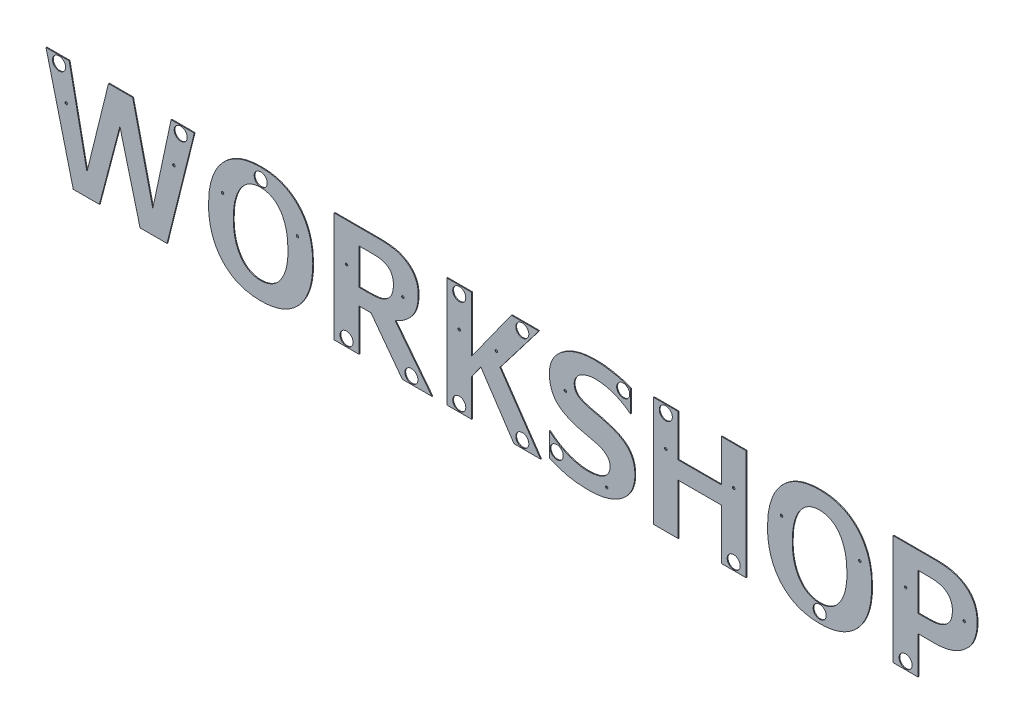
from build123d import *

# Parameters (mm, degrees)
SKETCH1_R           = 8
SKETCH1_R_2         = 1.5
BOSS_EXTRUDE1_DEPTH = 1
SKETCH2_R           = 1.5
SKETCH2_R_2         = 8
BOSS_EXTRUDE2_DEPTH = 1
SKETCH3_R           = 1.5
SKETCH3_R_2         = 8
BOSS_EXTRUDE3_DEPTH = 1
SKETCH4_R           = 8
SKETCH4_R_2         = 1.5
BOSS_EXTRUDE4_DEPTH = 1
SKETCH5_R           = 8
SKETCH5_R_2         = 1.5
BOSS_EXTRUDE5_DEPTH = 1
SKETCH6_R           = 8
SKETCH6_R_2         = 1.5
BOSS_EXTRUDE6_DEPTH = 1
SKETCH7_R           = 1.5
SKETCH7_R_2         = 8
BOSS_EXTRUDE7_DEPTH = 1
SKETCH8_R           = 8
SKETCH8_R_2         = 1.5
BOSS_EXTRUDE8_DEPTH = 1


with BuildPart() as part:
    # Sketch1 → Boss-Extrude1 (new body)
    with BuildSketch(Plane.XY):
        Polygon((2759.755662355, -1507.082577839), (2731.301339676, -1507.082577839), (2708.823457027, -1612.534372983), (2684.156370443, -1507.082577839), (2654.494132589, -1507.082577839), (2628.049756893, -1614.182299409), (2606.24852158, -1507.082577839), (2577.817119002, -1507.082577839), (2611.264112673, -1641.082577839), (2643.35275597, -1641.082577839), (2668.475428509, -1545.628632482), (2693.231792335, -1641.082577839), (2726.308668685, -1641.082577839), align=None)
        with Locations((2593.836071001, -1516.082577839)):
            Circle(SKETCH1_R, mode=Mode.SUBTRACT)
        with Locations((2602.702061357, -1553.882724844)):
            Circle(SKETCH1_R_2, mode=Mode.SUBTRACT)
        with Locations((2734.646317255, -1553.882724844)):
            Circle(SKETCH1_R_2, mode=Mode.SUBTRACT)
        with Locations((2743.072153395, -1516.082577839)):
            Circle(SKETCH1_R, mode=Mode.SUBTRACT)
    extrude(amount=BOSS_EXTRUDE1_DEPTH)


with BuildPart() as body_2:
    # Sketch2 → Boss-Extrude2 (new body)
    with BuildSketch(Plane.XY.offset(-0.5)):
        with BuildLine():
            add(Edge.make_bspline(
                [(2904.640412161, -1574.138154088), (2904.599424902, -1571.881958298), (2904.558217204, -1569.625798751), (2904.3384478, -1565.136062855), (2904.149464239, -1562.904200024), (2903.613515164, -1558.466449124), (2903.271985358, -1556.259667336), (2902.426310264, -1551.872840348), (2901.921696825, -1549.692872119), (2900.710114641, -1545.366206109), (2899.997230514, -1543.218478156), (2898.758112535, -1540.030930233), (2898.320738683, -1538.982458051), (2897.401210027, -1536.911357394), (2896.919022802, -1535.88874763), (2895.901473769, -1533.874215891), (2895.365947538, -1532.882388806), (2894.234287215, -1530.933712272), (2893.638174633, -1529.97685041), (2892.391244374, -1528.094697754), (2891.74062578, -1527.169292066), (2890.387715669, -1525.34830185), (2889.683920913, -1524.451125823), (2887.495195291, -1521.820516603), (2885.950453946, -1520.168210181), (2882.678126978, -1517.080284478), (2880.948462452, -1515.647128887), (2878.220777499, -1513.655235621), (2877.289960467, -1513.016855793), (2875.859332393, -1512.100056184), (2875.376695376, -1511.801283614), (2874.399459292, -1511.217914597), (2873.903931492, -1510.932812578), (2871.407535869, -1509.550811843), (2869.357387674, -1508.589926045), (2865.169875267, -1506.906152635), (2863.03230138, -1506.183837192), (2859.761160263, -1505.277138791), (2858.660061851, -1505.00415376), (2856.437639784, -1504.513375063), (2855.316606002, -1504.295841356), (2851.953254525, -1503.724954012), (2849.700739624, -1503.453430079), (2845.174090452, -1503.139744071), (2842.900735598, -1503.089313082), (2840.627384928, -1503.038837703)],
                knots=[0, 0, 0, 0, 0.0625, 0.0625, 0.125, 0.125, 0.1875, 0.1875, 0.25, 0.25, 0.3125, 0.3125, 0.34375, 0.34375, 0.375, 0.375, 0.40625, 0.40625, 0.4375, 0.4375, 0.46875, 0.46875, 0.5, 0.5, 0.5625, 0.5625, 0.625, 0.625, 0.65625, 0.65625, 0.671875, 0.671875, 0.6875, 0.6875, 0.75, 0.75, 0.8125, 0.8125, 0.84375, 0.84375, 0.875, 0.875, 0.9375, 0.9375, 1, 1, 1, 1], degree=3))
            add(Edge.make_bspline(
                [(2840.627384928, -1503.038837703), (2838.370165297, -1503.084690575), (2836.112987146, -1503.130774037), (2831.639016621, -1503.447447188), (2829.42426755, -1503.729395685), (2825.026884477, -1504.471821698), (2822.842703797, -1504.923701163), (2818.519229103, -1506.076986959), (2816.38102695, -1506.784462985), (2813.738759412, -1507.838276264), (2813.211320983, -1508.057674174), (2812.167571791, -1508.510454737), (2810.615848545, -1509.211717034), (2809.10659788, -1509.980478927), (2806.146490118, -1511.610804758), (2804.250429749, -1512.820608962), (2801.512799625, -1514.804507625), (2800.6183518, -1515.494565553), (2799.305642772, -1516.575681461), (2798.872891952, -1516.943711803), (2798.017317088, -1517.695548626), (2797.594489795, -1518.079419388), (2795.520860393, -1520.024775908), (2793.974776075, -1521.671653536), (2791.078162883, -1525.122437376), (2789.731157039, -1526.929172536), (2787.863490307, -1529.762005523), (2787.26545091, -1530.725969372), (2786.118086497, -1532.693014111), (2785.571702617, -1533.691345338), (2784.536303689, -1535.706744512), (2784.047125964, -1536.725617542), (2783.127299178, -1538.786292315), (2782.697082562, -1539.828263469), (2781.888846555, -1541.932654134), (2781.510777703, -1542.99505427), (2780.79967544, -1545.137497259), (2780.466352205, -1546.217426572), (2779.844581943, -1548.394865537), (2779.556309868, -1549.49381445), (2779.026405701, -1551.703870077), (2778.785498358, -1552.811569825), (2778.131410501, -1556.142295935), (2777.782085437, -1558.372418135), (2777.232328461, -1562.849208054), (2777.03830014, -1565.096587364), (2776.813129577, -1569.609446444), (2776.771414488, -1571.873751325), (2776.729847707, -1574.138072686)],
                knots=[0, 0, 0, 0, 0.0625, 0.0625, 0.125, 0.125, 0.1875, 0.1875, 0.25, 0.25, 0.265625, 0.265625, 0.28125, 0.3125, 0.3125, 0.375, 0.375, 0.40625, 0.40625, 0.421875, 0.421875, 0.4375, 0.4375, 0.5, 0.5, 0.5625, 0.5625, 0.59375, 0.59375, 0.625, 0.625, 0.65625, 0.65625, 0.6875, 0.6875, 0.71875, 0.71875, 0.75, 0.75, 0.78125, 0.78125, 0.8125, 0.8125, 0.875, 0.875, 0.9375, 0.9375, 1, 1, 1, 1], degree=3))
            add(Edge.make_bspline(
                [(2776.729847707, -1574.138072686), (2776.771005904, -1576.391456455), (2776.812383928, -1578.644804316), (2777.039123288, -1583.127981363), (2777.235420315, -1585.356024278), (2777.785683786, -1589.786355903), (2778.132978537, -1591.989734387), (2778.995099723, -1596.369126216), (2779.514498321, -1598.544392729), (2780.439402647, -1601.783476029), (2780.770613934, -1602.859428298), (2781.482888685, -1605.003189828), (2781.865238801, -1606.073681573), (2782.680779822, -1608.191874263), (2783.113370847, -1609.236950558), (2784.033551867, -1611.296036573), (2784.520890751, -1612.310188135), (2785.546148736, -1614.309920651), (2786.08390434, -1615.295593958), (2787.208167873, -1617.23940246), (2787.794813002, -1618.197460157), (2789.024068288, -1620.081963294), (2789.667806534, -1621.007771523), (2790.678244719, -1622.37116085), (2791.022446882, -1622.821449982), (2791.725549875, -1623.713725596), (2792.084858539, -1624.156162912), (2793.905961698, -1626.333785397), (2795.443425796, -1627.982526045), (2798.695257524, -1631.075056718), (2800.413546185, -1632.514304053), (2803.130474625, -1634.511563365), (2804.059054144, -1635.150743273), (2805.487447407, -1636.068357018), (2805.969508908, -1636.367357619), (2806.945716686, -1636.951358067), (2807.44041048, -1637.236624685), (2809.925870387, -1638.617223042), (2811.96592611, -1639.583309941), (2816.139818176, -1641.264390295), (2818.273773813, -1641.979064341), (2821.540085214, -1642.876028862), (2822.639634501, -1643.146157226), (2824.858309939, -1643.633997765), (2825.976019854, -1643.851235887), (2829.32964463, -1644.428867449), (2831.575244278, -1644.712589634), (2836.090487362, -1645.032596326), (2838.359109461, -1645.079391536), (2840.627720035, -1645.126305346)],
                knots=[0, 0, 0, 0, 0.0625, 0.0625, 0.125, 0.125, 0.1875, 0.1875, 0.25, 0.25, 0.28125, 0.28125, 0.3125, 0.3125, 0.34375, 0.34375, 0.375, 0.375, 0.40625, 0.40625, 0.4375, 0.4375, 0.46875, 0.46875, 0.484375, 0.484375, 0.5, 0.5, 0.5625, 0.5625, 0.625, 0.625, 0.65625, 0.65625, 0.671875, 0.671875, 0.6875, 0.6875, 0.75, 0.75, 0.8125, 0.8125, 0.84375, 0.84375, 0.875, 0.875, 0.9375, 0.9375, 1, 1, 1, 1], degree=3))
            add(Edge.make_bspline(
                [(2840.627720035, -1645.126305346), (2842.885693296, -1645.075954102), (2845.143614543, -1645.025310654), (2849.622975166, -1644.719073001), (2851.84298178, -1644.455429704), (2856.245197117, -1643.715799115), (2858.427660185, -1643.241240696), (2862.753134266, -1642.070486957), (2864.896518874, -1641.376390452), (2867.544750209, -1640.334618785), (2868.072767763, -1640.117470454), (2869.117212144, -1639.668700797), (2870.669654097, -1638.972649317), (2872.179333786, -1638.207764548), (2875.14159505, -1636.586085675), (2877.040628514, -1635.382941286), (2879.781077495, -1633.404217019), (2880.676361998, -1632.715348633), (2882.429525512, -1631.277401223), (2883.290169037, -1630.52564977), (2885.786752736, -1628.204739083), (2887.341534643, -1626.568030521), (2890.247381667, -1623.128389278), (2891.601434792, -1621.327894684), (2893.487852316, -1618.509114702), (2894.09167209, -1617.549133821), (2895.244463778, -1615.58441857), (2895.788272687, -1614.586633692), (2896.816712121, -1612.569881847), (2897.30205654, -1611.550020247), (2898.224318874, -1609.491034519), (2898.661669831, -1608.452082641), (2899.899011575, -1605.305509292), (2900.620846101, -1603.166799738), (2901.549806022, -1599.897561878), (2901.835432997, -1598.796247238), (2902.359196114, -1596.584664664), (2902.597008528, -1595.476181163), (2903.24631502, -1592.143557423), (2903.594887783, -1589.912379227), (2904.142553387, -1585.433303009), (2904.335537823, -1583.184721743), (2904.558662159, -1578.669344509), (2904.599609856, -1576.40375743), (2904.640412161, -1574.138154088)],
                knots=[0, 0, 0, 0, 0.0625, 0.0625, 0.125, 0.125, 0.1875, 0.1875, 0.25, 0.25, 0.265625, 0.265625, 0.28125, 0.3125, 0.3125, 0.375, 0.375, 0.40625, 0.40625, 0.4375, 0.4375, 0.5, 0.5, 0.5625, 0.5625, 0.59375, 0.59375, 0.625, 0.625, 0.65625, 0.65625, 0.6875, 0.6875, 0.75, 0.75, 0.78125, 0.78125, 0.8125, 0.8125, 0.875, 0.875, 0.9375, 0.9375, 1, 1, 1, 1], degree=3))
        make_face()
        with Locations((2793.950399869, -1553.882724844)):
            Circle(SKETCH2_R, mode=Mode.SUBTRACT)
        with Locations((2885.883859605, -1553.882724844)):
            Circle(SKETCH2_R, mode=Mode.SUBTRACT)
        with Locations((2840.740504603, -1516.082577839)):
            Circle(SKETCH2_R_2, mode=Mode.SUBTRACT)
        with BuildLine():
            add(Edge.make_bspline(
                [(2864.360405759, -1536.436135911), (2863.633720327, -1535.553149345), (2862.907370028, -1534.669800364), (2861.380251656, -1532.983578207), (2860.579110094, -1532.181108922), (2858.869209126, -1530.692548901), (2857.957382694, -1530.009774864), (2856.516055787, -1529.065191488), (2856.021967565, -1528.762044422), (2855.023934086, -1528.189370761), (2854.518987239, -1527.919443126), (2851.963604965, -1526.65461111), (2849.818598155, -1525.921395116), (2847.037470939, -1525.281221718), (2846.476521634, -1525.166258432), (2845.343140145, -1524.968106126), (2844.771524008, -1524.885185757), (2843.056115205, -1524.696523652), (2841.905579734, -1524.65756686), (2840.754959407, -1524.619673184)],
                knots=[0, 0, 0, 0, 0.125, 0.125, 0.25, 0.25, 0.375, 0.375, 0.4375, 0.4375, 0.5, 0.5, 0.75, 0.75, 0.8125, 0.8125, 0.875, 0.875, 1, 1, 1, 1], degree=3))
            add(Edge.make_bspline(
                [(2840.754959407, -1524.619673184), (2839.613485668, -1524.644060725), (2838.472177084, -1524.669334027), (2836.218752304, -1524.876445778), (2835.105908681, -1525.054382885), (2832.898924166, -1525.51056393), (2831.805222003, -1525.791160864), (2830.186602584, -1526.329692172), (2829.650604353, -1526.528196844), (2828.585513013, -1526.962239878), (2828.06025369, -1527.196320867), (2826.51882984, -1527.94294569), (2825.534907969, -1528.507337637), (2824.13713938, -1529.473065245), (2823.683005045, -1529.812954292), (2822.791229584, -1530.517887804), (2822.352955023, -1530.881966155), (2821.488947466, -1531.629251231), (2821.063096127, -1532.014298823), (2820.236071733, -1532.805466737), (2819.834884494, -1533.212398338), (2818.66975282, -1534.468575854), (2817.941116035, -1535.350329678), (2817.212092919, -1536.231727806)],
                knots=[0, 0, 0, 0, 0.125, 0.125, 0.25, 0.25, 0.375, 0.375, 0.4375, 0.4375, 0.5, 0.5, 0.625, 0.625, 0.6875, 0.6875, 0.75, 0.75, 0.8125, 0.8125, 0.875, 0.875, 1, 1, 1, 1], degree=3))
            add(Edge.make_bspline(
                [(2817.212092919, -1536.231727806), (2816.72901279, -1536.913130491), (2816.245489604, -1537.594317747), (2815.32191026, -1538.977827453), (2814.884943724, -1539.681652185), (2814.072834103, -1541.119362382), (2813.694717842, -1541.851802184), (2812.975686264, -1543.334770192), (2812.633591197, -1544.084724762), (2811.983497189, -1545.601212636), (2811.675810395, -1546.367897716), (2811.097298324, -1547.91919124), (2810.826547276, -1548.703835776), (2810.315934796, -1550.288144464), (2810.075863674, -1551.088442686), (2809.622765716, -1552.692190685), (2809.196539298, -1554.301479277), (2808.836269552, -1555.924367358), (2808.514764283, -1557.555248216), (2808.373309785, -1558.374667693), (2808.119956635, -1560.019600714), (2808.008078372, -1560.845118462), (2807.804684631, -1562.500352523), (2807.712465185, -1563.329384594), (2807.468061789, -1565.817189329), (2807.351141971, -1567.478331942), (2807.218147648, -1570.806328582), (2807.19525249, -1572.472796319), (2807.172209694, -1574.139255695)],
                knots=[0, 0, 0, 0, 0.0625, 0.0625, 0.125, 0.125, 0.1875, 0.1875, 0.25, 0.25, 0.3125, 0.3125, 0.375, 0.375, 0.4375, 0.4375, 0.5, 0.5625, 0.5625, 0.625, 0.625, 0.6875, 0.6875, 0.75, 0.75, 0.875, 0.875, 1, 1, 1, 1], degree=3))
            add(Edge.make_bspline(
                [(2807.172209694, -1574.139255695), (2807.196756449, -1575.790457688), (2807.221154091, -1577.441666078), (2807.341523724, -1580.741012911), (2807.441922113, -1582.3889615), (2807.737506354, -1585.680793084), (2807.927867745, -1587.320596255), (2808.415953288, -1590.582796362), (2808.717459338, -1592.204877598), (2809.464519318, -1595.426431863), (2809.904702647, -1597.012355482), (2810.922818439, -1600.117789109), (2811.503469992, -1601.638450272), (2812.478286034, -1603.872948827), (2812.819606918, -1604.610446641), (2813.536223061, -1606.070230436), (2813.91268475, -1606.791994156), (2814.718201261, -1608.211973321), (2815.150267072, -1608.908840612), (2816.058462972, -1610.282845668), (2816.532152554, -1610.961076154), (2817.005430821, -1611.639490805)],
                knots=[0, 0, 0, 0, 0.125, 0.125, 0.25, 0.25, 0.375, 0.375, 0.5, 0.5, 0.625, 0.625, 0.75, 0.75, 0.8125, 0.8125, 0.875, 0.875, 0.9375, 0.9375, 1, 1, 1, 1], degree=3))
            add(Edge.make_bspline(
                [(2817.005430821, -1611.639490805), (2817.730183995, -1612.532827844), (2818.45476254, -1613.426357204), (2819.985199531, -1615.123901408), (2820.792210468, -1615.926647001), (2822.503570651, -1617.424938356), (2823.408222546, -1618.120150807), (2825.322496048, -1619.394971324), (2826.340718937, -1619.976279953), (2829.447089359, -1621.496137809), (2831.610122164, -1622.237450518), (2834.409246662, -1622.882677275), (2834.973780902, -1622.997821163), (2836.113769773, -1623.195873132), (2836.690227115, -1623.278662191), (2838.420078655, -1623.46740589), (2839.579683527, -1623.507014853), (2840.739336385, -1623.54597436)],
                knots=[0, 0, 0, 0, 0.125, 0.125, 0.25, 0.25, 0.375, 0.375, 0.5, 0.5, 0.75, 0.75, 0.8125, 0.8125, 0.875, 0.875, 1, 1, 1, 1], degree=3))
            add(Edge.make_bspline(
                [(2840.739336385, -1623.54597436), (2841.898765769, -1623.508106528), (2843.057978041, -1623.469190294), (2845.341526931, -1623.22294877), (2846.467370806, -1623.022901786), (2848.689873557, -1622.481878037), (2849.786766434, -1622.14203123), (2851.416986258, -1621.559251367), (2851.957630449, -1621.351652134), (2853.031656043, -1620.901382807), (2853.559892455, -1620.660481739), (2855.110178064, -1619.886869891), (2856.101705315, -1619.305421918), (2858.01141713, -1618.02777569), (2858.928632281, -1617.330060712), (2860.239561428, -1616.181957242), (2860.665341317, -1615.782880089), (2861.486689853, -1614.962448122), (2861.883592648, -1614.539950493), (2863.036043372, -1613.238338743), (2863.753918546, -1612.325627389), (2864.4720951, -1611.41318481)],
                knots=[0, 0, 0, 0, 0.125, 0.125, 0.25, 0.25, 0.375, 0.375, 0.4375, 0.4375, 0.5, 0.5, 0.625, 0.625, 0.75, 0.75, 0.8125, 0.8125, 0.875, 0.875, 1, 1, 1, 1], degree=3))
            add(Edge.make_bspline(
                [(2864.4720951, -1611.41318481), (2864.930812822, -1610.730312721), (2865.38991759, -1610.04765827), (2866.279426882, -1608.666210966), (2866.708480936, -1607.966658731), (2867.924030641, -1605.827733703), (2868.649238784, -1604.353898397), (2869.967804621, -1601.3320871), (2870.553272182, -1599.800295445), (2871.580546574, -1596.70315457), (2872.019231088, -1595.135839527), (2872.747789104, -1591.963993912), (2873.034787488, -1590.358744314), (2873.381000444, -1587.929791525), (2873.482904977, -1587.11676449), (2873.668125584, -1585.48606171), (2873.751360289, -1584.66844159), (2873.895958654, -1583.033455659), (2873.9574034, -1582.21545449), (2874.056072226, -1580.578318142), (2874.092411483, -1579.759141536), (2874.171005892, -1577.300187299), (2874.184459609, -1575.659061187), (2874.197943563, -1574.01793649)],
                knots=[0, 0, 0, 0, 0.0625, 0.0625, 0.125, 0.125, 0.25, 0.25, 0.375, 0.375, 0.5, 0.5, 0.625, 0.625, 0.6875, 0.6875, 0.75, 0.75, 0.8125, 0.8125, 0.875, 0.875, 1, 1, 1, 1], degree=3))
            add(Edge.make_bspline(
                [(2874.197943563, -1574.01793649), (2874.172125838, -1572.36572337), (2874.146398325, -1570.713506204), (2874.020949863, -1567.412390657), (2873.917369239, -1565.763665392), (2873.455495948, -1560.824268208), (2872.96074873, -1557.560320695), (2872.009686891, -1553.536141073), (2871.803038981, -1552.735825072), (2871.35665651, -1551.152186985), (2871.116631284, -1550.367815195), (2870.606172259, -1548.812524184), (2870.335761324, -1548.041594846), (2869.767493528, -1546.511878082), (2869.469373674, -1545.753207001), (2868.840654231, -1544.250233675), (2868.510304959, -1543.505820692), (2867.810953359, -1542.0340946), (2867.441318158, -1541.307061472), (2866.645346092, -1539.878079685), (2866.215965975, -1539.177477342), (2865.309225241, -1537.797498936), (2864.834565746, -1537.116927914), (2864.360405759, -1536.436135911)],
                knots=[0, 0, 0, 0, 0.125, 0.125, 0.25, 0.25, 0.5, 0.5, 0.5625, 0.5625, 0.625, 0.625, 0.6875, 0.6875, 0.75, 0.75, 0.8125, 0.8125, 0.875, 0.875, 0.9375, 0.9375, 1, 1, 1, 1], degree=3))
        make_face(mode=Mode.SUBTRACT)
    extrude(amount=BOSS_EXTRUDE2_DEPTH)


with BuildPart() as body_3:
    # Sketch3 → Boss-Extrude3 (new body)
    with BuildSketch(Plane.XY.offset(-0.5)):
        with BuildLine():
            Line((3050.878080136, -1641.582577839), (3005.740127588, -1583.767239691))
            add(Edge.make_bspline(
                [(3005.740127588, -1583.767239691), (3006.723035758, -1583.259422493), (3007.706669908, -1582.752634859), (3009.671704815, -1581.735892257), (3010.653399226, -1581.226353741), (3012.589043332, -1580.167929948), (3013.541769008, -1579.617308802), (3015.395810038, -1578.443157866), (3016.297271213, -1577.819834874), (3018.057098076, -1576.512072107), (3018.916258388, -1575.828759246), (3020.595413275, -1574.406589796), (3021.414432354, -1573.666349788), (3023.006110399, -1572.12012319), (3023.779912392, -1571.312743933), (3025.269327491, -1569.628053217), (3025.976024558, -1568.761898474), (3027.312199469, -1566.981219642), (3027.943467679, -1566.06781702), (3029.108211416, -1564.179755421), (3029.639291226, -1563.203595791), (3030.357725626, -1561.690381848), (3030.583908565, -1561.177649224), (3031.01374527, -1560.138071929), (3031.21786923, -1559.610570663), (3031.795883356, -1558.024324766), (3032.136478555, -1556.956941473), (3032.718411815, -1554.800246114), (3032.958608306, -1553.710681842), (3033.348317079, -1551.511518534), (3033.501021445, -1550.402624721), (3033.762537326, -1548.175139895), (3033.866961302, -1547.053541705), (3033.979142104, -1544.808874676), (3033.993163643, -1543.684842754), (3034.007489955, -1542.560823136)],
                knots=[0, 0, 0, 0, 0.0625, 0.0625, 0.125, 0.125, 0.1875, 0.1875, 0.25, 0.25, 0.3125, 0.3125, 0.375, 0.375, 0.4375, 0.4375, 0.5, 0.5, 0.5625, 0.5625, 0.625, 0.625, 0.65625, 0.65625, 0.6875, 0.6875, 0.75, 0.75, 0.8125, 0.8125, 0.875, 0.875, 0.9375, 0.9375, 1, 1, 1, 1], degree=3))
            add(Edge.make_bspline(
                [(3034.007489955, -1542.560823136), (3033.9698884, -1541.134128517), (3033.93240101, -1539.707418005), (3033.770895845, -1537.582007403), (3033.697745128, -1536.876226129), (3033.507151109, -1535.470829536), (3033.390658968, -1534.771081806), (3033.117966945, -1533.377114046), (3032.96243536, -1532.682800983), (3032.609740933, -1531.299970329), (3032.410971883, -1530.60899312), (3031.957507897, -1529.247368753), (3031.703270787, -1528.581599335), (3031.135832394, -1527.28230847), (3030.824179913, -1526.647939971), (3029.82125269, -1524.782007683), (3029.066651542, -1523.585077605), (3027.812354004, -1521.856621725), (3027.371525698, -1521.290205949), (3026.459302774, -1520.192141943), (3025.987727525, -1519.659654462), (3024.531519156, -1518.106573784), (3023.509454083, -1517.126028588), (3021.30701686, -1515.33430906), (3020.121054905, -1514.52808981), (3018.937320355, -1513.723317291)],
                knots=[0, 0, 0, 0, 0.125, 0.125, 0.1875, 0.1875, 0.25, 0.25, 0.3125, 0.3125, 0.375, 0.375, 0.4375, 0.4375, 0.5, 0.5, 0.625, 0.625, 0.6875, 0.6875, 0.75, 0.75, 0.875, 0.875, 1, 1, 1, 1], degree=3))
            add(Edge.make_bspline(
                [(3018.937320355, -1513.723317291), (3017.650135804, -1512.955523753), (3016.36244116, -1512.188779274), (3013.682119391, -1510.87109466), (3012.296807506, -1510.305109989), (3010.1758468, -1509.544552221), (3009.464104135, -1509.309429976), (3008.030670917, -1508.885279143), (3007.308523157, -1508.697047792), (3005.127580198, -1508.196010835), (3003.655581846, -1507.941170263), (3000.6934006, -1507.51132365), (2999.205451725, -1507.336651497), (2996.230333787, -1507.035461341), (2994.741050075, -1506.913649624), (2991.758810263, -1506.731312801), (2990.265847512, -1506.670898678), (2987.27673007, -1506.603339105), (2985.780769101, -1506.592960702), (2984.2848084, -1506.582577839)],
                knots=[0, 0, 0, 0, 0.125, 0.125, 0.25, 0.25, 0.3125, 0.3125, 0.375, 0.375, 0.5, 0.5, 0.625, 0.625, 0.75, 0.75, 0.875, 0.875, 1, 1, 1, 1], degree=3))
            Line((2984.2848084, -1506.582577839), (2930.906643843, -1506.582577839))
            Line((2930.906643843, -1506.582577839), (2930.906643843, -1641.582577839))
            Line((2930.906643843, -1641.582577839), (2961.349681818, -1641.582577839))
            Line((2961.349681818, -1641.582577839), (2961.349681818, -1590.190172775))
            Line((2961.349681818, -1590.190172775), (2976.066489744, -1590.190172775))
            Line((2976.066489744, -1590.190172775), (3014.527723921, -1641.582577839))
            Line((3014.527723921, -1641.582577839), (3050.878080136, -1641.582577839))
        make_face()
        with Locations((3015.241559587, -1553.882724844)):
            Circle(SKETCH3_R, mode=Mode.SUBTRACT)
        with Locations((2946.128162831, -1553.882724844)):
            Circle(SKETCH3_R, mode=Mode.SUBTRACT)
        with Locations((2946.099681818, -1632.582577839)):
            Circle(SKETCH3_R_2, mode=Mode.SUBTRACT)
        with Locations((3025.670217733, -1632.582577839)):
            Circle(SKETCH3_R_2, mode=Mode.SUBTRACT)
        with BuildLine():
            Line((2961.349681818, -1570.380046193), (2973.744355522, -1570.380002117))
            add(Edge.make_bspline(
                [(2973.744355522, -1570.380002117), (2975.709572857, -1570.361550087), (2977.674731035, -1570.341053765), (2980.617996705, -1570.155782519), (2981.596558822, -1570.066091454), (2983.060698464, -1569.903318185), (2983.548313734, -1569.845291517), (2984.522798685, -1569.722722527), (2985.00952372, -1569.656916146), (2985.980562247, -1569.504229039), (2986.464834856, -1569.417209688), (2987.42179263, -1569.215033513), (2987.895539132, -1569.100445087), (2989.30057408, -1568.71045216), (2990.215131795, -1568.387318971), (2991.556234412, -1567.814942713), (2991.998479218, -1567.610487639), (2992.871346809, -1567.168422704), (2993.303676518, -1566.929074461), (2994.14017347, -1566.410707896), (2994.543507328, -1566.130521164), (2995.331009195, -1565.543157473), (2995.715578684, -1565.236545896), (2996.100217518, -1564.930031973)],
                knots=[0, 0, 0, 0, 0.25, 0.25, 0.375, 0.375, 0.4375, 0.4375, 0.5, 0.5, 0.5625, 0.5625, 0.625, 0.625, 0.75, 0.75, 0.8125, 0.8125, 0.875, 0.875, 0.9375, 0.9375, 1, 1, 1, 1], degree=3))
            add(Edge.make_bspline(
                [(2996.100217518, -1564.930031973), (2996.750187944, -1564.367318701), (2997.39793098, -1563.802768), (2998.578993561, -1562.579275836), (2999.119289103, -1561.926089046), (3000.110686567, -1560.546137446), (3000.562034514, -1559.819575589), (3001.380174375, -1558.296699517), (3001.736574478, -1557.515054375), (3002.337628095, -1555.919691372), (3002.582082291, -1555.104217859), (3002.970584835, -1553.441411753), (3003.118147761, -1552.593038037), (3003.350144817, -1550.886480845), (3003.430894799, -1550.03070905), (3003.527926011, -1548.314605458), (3003.546526253, -1547.454437689), (3003.565297852, -1546.59428204)],
                knots=[0, 0, 0, 0, 0.125, 0.125, 0.25, 0.25, 0.375, 0.375, 0.5, 0.5, 0.625, 0.625, 0.75, 0.75, 0.875, 0.875, 1, 1, 1, 1], degree=3))
            add(Edge.make_bspline(
                [(3003.565297852, -1546.59428204), (3003.551157961, -1545.689246247), (3003.535995809, -1544.784371318), (3003.380682606, -1542.994289789), (3003.238884198, -1542.109342419), (3002.880712234, -1540.351182871), (3002.669089949, -1539.47722303), (3002.238732955, -1538.18405299), (3002.075681694, -1537.756736798), (3001.720712674, -1536.922686561), (3001.528056527, -1536.513888916), (3000.912602093, -1535.307824376), (3000.452882026, -1534.530579908), (2999.629409482, -1533.437322153), (2999.334107398, -1533.086755785), (2998.717903072, -1532.42278481), (2998.395440647, -1532.107220756), (2997.39233147, -1531.201377758), (2996.67510213, -1530.652932207), (2995.51771687, -1529.92350898), (2995.119653735, -1529.697043199), (2994.315407031, -1529.2641388), (2993.908220956, -1529.057042016), (2993.501237424, -1528.849570952)],
                knots=[0, 0, 0, 0, 0.125, 0.125, 0.25, 0.25, 0.375, 0.375, 0.4375, 0.4375, 0.5, 0.5, 0.625, 0.625, 0.6875, 0.6875, 0.75, 0.75, 0.875, 0.875, 0.9375, 0.9375, 1, 1, 1, 1], degree=3))
            add(Edge.make_bspline(
                [(2993.501237424, -1528.849570952), (2992.786203204, -1528.573806674), (2992.071481885, -1528.2971021), (2990.625087386, -1527.794634862), (2989.892874916, -1527.570492813), (2988.399600463, -1527.208904171), (2987.645465603, -1527.069600021), (2986.130069747, -1526.851303997), (2985.367836, -1526.773862822), (2984.220974299, -1526.682244645), (2983.838269662, -1526.655617284), (2983.07306972, -1526.603112454), (2982.690473664, -1526.576743634), (2981.542477148, -1526.503832762), (2980.776740639, -1526.467283835), (2979.244103531, -1526.428802463), (2978.477342105, -1526.422731429), (2976.94393058, -1526.407278872), (2976.177210162, -1526.399988422), (2975.410487291, -1526.39277091)],
                knots=[0, 0, 0, 0, 0.125, 0.125, 0.25, 0.25, 0.375, 0.375, 0.5, 0.5, 0.5625, 0.5625, 0.625, 0.625, 0.75, 0.75, 0.875, 0.875, 1, 1, 1, 1], degree=3))
            Line((2975.410487291, -1526.39277091), (2961.349681818, -1526.39269933))
            Line((2961.349681818, -1526.39269933), (2961.349681818, -1570.380046193))
        make_face(mode=Mode.SUBTRACT)
    extrude(amount=BOSS_EXTRUDE3_DEPTH)


with BuildPart() as body_4:
    # Sketch4 → Boss-Extrude4 (new body)
    with BuildSketch(Plane.XY.offset(-0.5)):
        Polygon((3184.166356302, -1641.582577839), (3134.350908854, -1568.962963754), (3182.080147011, -1506.582577839), (3148.274806429, -1506.582577839), (3099.577529919, -1574.554608676), (3099.577529919, -1506.582577839), (3069.134491945, -1506.582577839), (3069.134491945, -1641.582577839), (3099.577529919, -1641.582577839), (3099.577529919, -1596.038618424), (3110.851801276, -1580.347992363), (3151.570086065, -1641.582577839), align=None)
        with Locations((3084.356010932, -1516.082577839)):
            Circle(SKETCH4_R, mode=Mode.SUBTRACT)
        with Locations((3084.356010932, -1553.882724844)):
            Circle(SKETCH4_R_2, mode=Mode.SUBTRACT)
        with Locations((3084.356010932, -1632.582577839)):
            Circle(SKETCH4_R, mode=Mode.SUBTRACT)
        with Locations((3161.705224366, -1632.582577839)):
            Circle(SKETCH4_R, mode=Mode.SUBTRACT)
        with Locations((3129.954991647, -1553.882724844)):
            Circle(SKETCH4_R_2, mode=Mode.SUBTRACT)
        with Locations((3161.705224366, -1516.082577839)):
            Circle(SKETCH4_R, mode=Mode.SUBTRACT)
    extrude(amount=BOSS_EXTRUDE4_DEPTH)


with BuildPart() as body_5:
    # Sketch5 → Boss-Extrude5 (new body)
    with BuildSketch(Plane.XY.offset(-0.5)):
        with BuildLine():
            Line((3294.51423878, -1538.565256026), (3294.51423878, -1511.481499499))
            add(Edge.make_bspline(
                [(3294.51423878, -1511.481499499), (3293.640708407, -1511.120210328), (3292.765396311, -1510.764084451), (3291.003905672, -1510.083322835), (3290.117578345, -1509.759118258), (3287.441550334, -1508.835902614), (3285.63707325, -1508.279712425), (3280.182909803, -1506.729180649), (3276.501337202, -1505.879518711), (3270.933444698, -1504.81335102), (3269.070700397, -1504.498018576), (3265.338471073, -1503.971316005), (3263.46802413, -1503.755636245), (3259.720216095, -1503.400358609), (3257.842574224, -1503.263850362), (3254.077305578, -1503.10070569), (3252.190083797, -1503.069612799), (3250.302851624, -1503.038634264)],
                knots=[0, 0, 0, 0, 0.0625, 0.0625, 0.125, 0.125, 0.25, 0.25, 0.5, 0.5, 0.625, 0.625, 0.75, 0.75, 0.875, 0.875, 1, 1, 1, 1], degree=3))
            add(Edge.make_bspline(
                [(3250.302851624, -1503.038634264), (3248.683536043, -1503.067067315), (3247.06424282, -1503.095645079), (3243.840011915, -1503.245718569), (3242.236267412, -1503.374937292), (3239.045010486, -1503.738438829), (3237.457021876, -1503.969639461), (3234.295983781, -1504.52873601), (3232.722768915, -1504.855561475), (3229.593825362, -1505.622393803), (3228.038459337, -1506.064748041), (3225.722059314, -1506.836042134), (3224.952909433, -1507.111184893), (3223.435028385, -1507.691439684), (3222.684368988, -1507.997167169), (3220.456288862, -1508.959369079), (3219.000875665, -1509.657301562), (3216.145045682, -1511.156769425), (3214.748275847, -1511.965174977), (3212.713432882, -1513.291399376), (3212.044363683, -1513.750827455), (3210.723771902, -1514.702738142), (3210.071031494, -1515.196539455), (3208.154882159, -1516.714720247), (3206.932570687, -1517.780575542), (3204.625691248, -1520.046564516), (3203.539591324, -1521.245204776), (3202.02385771, -1523.153728301), (3201.537456369, -1523.808271982), (3200.605896969, -1525.157565094), (3200.166556814, -1525.84405041), (3198.93040911, -1527.93789894), (3198.219275695, -1529.382266719), (3197.009492799, -1532.362170581), (3196.507526536, -1533.896283567), (3195.903391713, -1536.261303389), (3195.72580387, -1537.062523974), (3195.429423944, -1538.667563731), (3195.31015819, -1539.472987566), (3195.046006968, -1541.898661025), (3195.00224808, -1543.529063639), (3194.957856154, -1545.159402697)],
                knots=[0, 0, 0, 0, 0.0625, 0.0625, 0.125, 0.125, 0.1875, 0.1875, 0.25, 0.25, 0.3125, 0.3125, 0.34375, 0.34375, 0.375, 0.375, 0.4375, 0.4375, 0.5, 0.5, 0.53125, 0.53125, 0.5625, 0.5625, 0.625, 0.625, 0.6875, 0.6875, 0.71875, 0.71875, 0.75, 0.75, 0.8125, 0.8125, 0.875, 0.875, 0.90625, 0.90625, 0.9375, 0.9375, 1, 1, 1, 1], degree=3))
            add(Edge.make_bspline(
                [(3194.957856154, -1545.159402697), (3194.976071783, -1546.228896791), (3194.994511131, -1547.298353082), (3195.104011176, -1549.424993925), (3195.198193346, -1550.481651005), (3195.461777645, -1552.582254307), (3195.631515403, -1553.626143815), (3196.032164804, -1555.703585515), (3196.259702357, -1556.73770787), (3196.819791855, -1558.788206985), (3197.156225195, -1559.803927858), (3197.722697206, -1561.317062332), (3197.921429471, -1561.818804829), (3198.341926243, -1562.806126219), (3198.564000976, -1563.292806766), (3199.03686204, -1564.249221697), (3199.287056487, -1564.719305423), (3199.806004538, -1565.648518887), (3200.073865141, -1566.108175692), (3200.627316617, -1567.01702454), (3200.913370109, -1567.465943536), (3201.515634206, -1568.345982193), (3201.833212696, -1568.776294501), (3202.498124498, -1569.619357221), (3202.84569882, -1570.033175619), (3203.559428217, -1570.844205074), (3203.924308827, -1571.240293015), (3205.044451175, -1572.398567994), (3205.826869417, -1573.128818731), (3207.457385085, -1574.51208088), (3208.304328812, -1575.16644905), (3210.049641991, -1576.414708263), (3210.949830114, -1577.011238863), (3213.699763711, -1578.702558052), (3215.600865141, -1579.688454032), (3218.513982585, -1581.038905956), (3219.497190168, -1581.46363851), (3221.487290609, -1582.263628534), (3222.492390292, -1582.642631683), (3223.497579439, -1583.021447955)],
                knots=[0, 0, 0, 0, 0.0625, 0.0625, 0.125, 0.125, 0.1875, 0.1875, 0.25, 0.25, 0.3125, 0.3125, 0.34375, 0.34375, 0.375, 0.375, 0.40625, 0.40625, 0.4375, 0.4375, 0.46875, 0.46875, 0.5, 0.5, 0.53125, 0.53125, 0.5625, 0.5625, 0.625, 0.625, 0.6875, 0.6875, 0.75, 0.75, 0.875, 0.875, 0.9375, 0.9375, 1, 1, 1, 1], degree=3))
            add(Edge.make_bspline(
                [(3223.497579439, -1583.021447955), (3225.963473116, -1583.829958425), (3228.429424433, -1584.638282999), (3233.434295988, -1586.019600116), (3235.963947487, -1586.598917035), (3241.029545741, -1587.73043202), (3243.565866964, -1588.281468124), (3248.615005479, -1589.481853732), (3251.127589265, -1590.132186449), (3253.640212787, -1590.782352931)],
                knots=[0, 0, 0, 0, 0.25, 0.25, 0.5, 0.5, 0.75, 0.75, 1, 1, 1, 1], degree=3))
            add(Edge.make_bspline(
                [(3253.640212787, -1590.782352931), (3254.604306339, -1591.078534756), (3255.568348151, -1591.374830067), (3257.460458352, -1592.046326674), (3258.388891666, -1592.420727519), (3260.182531169, -1593.308214883), (3261.046407879, -1593.824217547), (3262.321083492, -1594.644589916), (3262.744044212, -1594.926208), (3263.568998176, -1595.512523559), (3263.970677072, -1595.816919609), (3265.130048844, -1596.777634214), (3265.843410372, -1597.480091289), (3266.641383227, -1598.455712562), (3266.796298027, -1598.65570736), (3267.096002916, -1599.0662344), (3267.241206875, -1599.277474948), (3267.654928516, -1599.919427762), (3267.903107189, -1600.360090828), (3268.342862845, -1601.267417027), (3268.534355103, -1601.734119079), (3268.858493077, -1602.694554427), (3268.991498967, -1603.191364632), (3269.188046132, -1604.189553945), (3269.252002021, -1604.692872527), (3269.340587619, -1605.70435008), (3269.365027225, -1606.212532447), (3269.390342791, -1606.720607)],
                knots=[0, 0, 0, 0, 0.125, 0.125, 0.25, 0.25, 0.375, 0.375, 0.4375, 0.4375, 0.5, 0.5, 0.625, 0.625, 0.65625, 0.65625, 0.6875, 0.6875, 0.75, 0.75, 0.8125, 0.8125, 0.875, 0.875, 0.9375, 0.9375, 1, 1, 1, 1], degree=3))
            add(Edge.make_bspline(
                [(3269.390342791, -1606.720607), (3269.355492108, -1607.528196362), (3269.321281284, -1608.335905947), (3269.158543066, -1609.933604183), (3269.030394601, -1610.723664031), (3268.733275533, -1611.889045055), (3268.615755777, -1612.274033217), (3268.343686413, -1613.037052084), (3268.188392411, -1613.416757598), (3267.672732153, -1614.533998077), (3267.273102715, -1615.239881301), (3266.586193437, -1616.237723884), (3266.341821303, -1616.559599266), (3265.823407013, -1617.182663556), (3265.549614258, -1617.484026351), (3264.982630874, -1618.073227396), (3264.691410985, -1618.362292617), (3264.098813912, -1618.922542951), (3263.796344859, -1619.194115578), (3262.866819916, -1619.978177478), (3262.215012367, -1620.456360132), (3260.846217609, -1621.322384275), (3260.125457181, -1621.704995956), (3259.403387128, -1622.085792454)],
                knots=[0, 0, 0, 0, 0.125, 0.125, 0.25, 0.25, 0.3125, 0.3125, 0.375, 0.375, 0.5, 0.5, 0.5625, 0.5625, 0.625, 0.625, 0.6875, 0.6875, 0.75, 0.75, 0.875, 0.875, 1, 1, 1, 1], degree=3))
            add(Edge.make_bspline(
                [(3259.403387128, -1622.085792454), (3258.758528663, -1622.397387739), (3258.112822714, -1622.706729325), (3256.783439263, -1623.224435342), (3256.101796639, -1623.438211095), (3254.719992724, -1623.816516196), (3254.02134275, -1623.979961618), (3252.619255495, -1624.270878188), (3251.914773606, -1624.398842854), (3250.499874288, -1624.624572603), (3249.789422936, -1624.721705508), (3248.367983666, -1624.897915947), (3247.656626918, -1624.978853296), (3246.232418661, -1625.123911148), (3245.519654755, -1625.189017209), (3244.090605222, -1625.279608099), (3243.373789002, -1625.29912346), (3242.656884383, -1625.317644289)],
                knots=[0, 0, 0, 0, 0.125, 0.125, 0.25, 0.25, 0.375, 0.375, 0.5, 0.5, 0.625, 0.625, 0.75, 0.75, 0.875, 0.875, 1, 1, 1, 1], degree=3))
            add(Edge.make_bspline(
                [(3242.656884383, -1625.317644289), (3240.454251588, -1625.256980807), (3238.252281217, -1625.192951637), (3233.91560134, -1624.723149683), (3231.777681382, -1624.333688785), (3227.530939893, -1623.406921709), (3225.423563579, -1622.86227257), (3222.294593289, -1621.882232559), (3221.256880872, -1621.528737356), (3219.190844082, -1620.774047537), (3218.161373837, -1620.372004453), (3215.111925588, -1619.111990191), (3213.122324504, -1618.196574393), (3209.240400764, -1616.196585553), (3207.348025269, -1615.112104391), (3203.646683524, -1612.798101912), (3201.836591204, -1611.570538716), (3199.202365498, -1609.588494875), (3198.338176578, -1608.901480146), (3196.63398489, -1607.496782192), (3195.793868083, -1606.780207887), (3194.957276755, -1606.05944701)],
                knots=[0, 0, 0, 0, 0.125, 0.125, 0.25, 0.25, 0.375, 0.375, 0.4375, 0.4375, 0.5, 0.5, 0.625, 0.625, 0.75, 0.75, 0.875, 0.875, 0.9375, 0.9375, 1, 1, 1, 1], degree=3))
            Line((3194.957276755, -1606.05944701), (3194.957276755, -1635.133214283))
            add(Edge.make_bspline(
                [(3194.957276755, -1635.133214283), (3195.896273945, -1635.539435646), (3196.836945222, -1635.941212137), (3198.729368103, -1636.715345711), (3199.681262761, -1637.087322971), (3201.595941771, -1637.802364235), (3202.558205271, -1638.146811154), (3204.488235097, -1638.821094424), (3205.456028168, -1639.150859766), (3210.310043566, -1640.759727054), (3214.233210354, -1641.908404711), (3219.228585029, -1643.006784106), (3220.23200074, -1643.209742085), (3222.240360908, -1643.577065526), (3223.246297693, -1643.741614677), (3226.26854133, -1644.187028878), (3228.289100147, -1644.421633369), (3232.339261946, -1644.792443577), (3234.369441087, -1644.922380792), (3238.439946141, -1645.071860291), (3240.479547368, -1645.099287034), (3242.519155565, -1645.126637935)],
                knots=[0, 0, 0, 0, 0.0625, 0.0625, 0.125, 0.125, 0.1875, 0.1875, 0.25, 0.25, 0.5, 0.5, 0.5625, 0.5625, 0.625, 0.625, 0.75, 0.75, 0.875, 0.875, 1, 1, 1, 1], degree=3))
            add(Edge.make_bspline(
                [(3242.519155565, -1645.126637935), (3244.215657952, -1645.101970543), (3245.912140673, -1645.077190582), (3248.445502714, -1644.974987606), (3249.287923788, -1644.929283991), (3250.967756353, -1644.80920335), (3251.805298489, -1644.735574098), (3254.311606045, -1644.478519064), (3255.97452584, -1644.261634614), (3259.284031376, -1643.734374296), (3260.930206817, -1643.421649998), (3264.20080571, -1642.671699301), (3265.825220582, -1642.234423786), (3269.048604073, -1641.214225765), (3270.647818471, -1640.632710018), (3273.821036247, -1639.325377932), (3275.37400604, -1638.607846085), (3278.389947399, -1637.030412984), (3279.854689577, -1636.169670126), (3282.686841342, -1634.286011149), (3284.054976135, -1633.26430335), (3286.037177382, -1631.615107737), (3286.682118846, -1631.049247586), (3287.933571719, -1629.888859513), (3288.540910753, -1629.293546085), (3289.717324671, -1628.071455802), (3290.286153067, -1627.444476268), (3291.378443708, -1626.153214019), (3291.90135178, -1625.488475625), (3293.401571673, -1623.437931457), (3294.313336166, -1621.998228145), (3295.545359911, -1619.727154588), (3295.930248976, -1618.955554856), (3296.640441557, -1617.399018896), (3296.967188651, -1616.611766352), (3297.8645862, -1614.223753485), (3298.352024277, -1612.596621094), (3298.928307908, -1610.106839257), (3299.095099964, -1609.268892992), (3299.374845227, -1607.575937594), (3299.48775363, -1606.719329335), (3299.737859847, -1604.149577894), (3299.783706794, -1602.428684134), (3299.830120197, -1600.707826576)],
                knots=[0, 0, 0, 0, 0.0625, 0.0625, 0.09375, 0.09375, 0.125, 0.125, 0.1875, 0.1875, 0.25, 0.25, 0.3125, 0.3125, 0.375, 0.375, 0.4375, 0.4375, 0.5, 0.5, 0.5625, 0.5625, 0.59375, 0.59375, 0.625, 0.625, 0.65625, 0.65625, 0.6875, 0.6875, 0.75, 0.75, 0.78125, 0.78125, 0.8125, 0.8125, 0.875, 0.875, 0.90625, 0.90625, 0.9375, 0.9375, 1, 1, 1, 1], degree=3))
            add(Edge.make_bspline(
                [(3299.830120197, -1600.707826576), (3299.812914517, -1599.698226228), (3299.795495611, -1598.68865884), (3299.697497066, -1596.679287294), (3299.612842592, -1595.680113013), (3299.375938271, -1593.692213177), (3299.22519797, -1592.703254279), (3298.85209496, -1590.736407697), (3298.630261447, -1589.758438212), (3298.229931176, -1588.301930332), (3298.084670292, -1587.818254419), (3297.77062352, -1586.854539029), (3297.601492388, -1586.373270522), (3297.06567432, -1584.94703073), (3296.67411193, -1584.015598711), (3295.783862814, -1582.213218026), (3295.282796929, -1581.343612652), (3294.192464191, -1579.654200955), (3293.601855241, -1578.835152392), (3292.635809021, -1577.651823233), (3292.301920142, -1577.265177733), (3291.621035371, -1576.512463362), (3291.272912888, -1576.145275693), (3290.209121786, -1575.066903211), (3289.470537259, -1574.383078442), (3287.934944221, -1573.085183185), (3287.139948358, -1572.468709732), (3285.508091821, -1571.285746576), (3284.671907801, -1570.718448993), (3283.385237366, -1569.906179346), (3282.950265843, -1569.642010439), (3282.072710303, -1569.13311808), (3281.629339679, -1568.888422842), (3280.736072605, -1568.412887134), (3280.286210904, -1568.181972892), (3279.382718408, -1567.728146449), (3278.929414041, -1567.50454122), (3277.563445764, -1566.84658108), (3276.643435266, -1566.427823474), (3274.771766528, -1565.657498562), (3273.823102989, -1565.299573301), (3272.874452735, -1564.941619837)],
                knots=[0, 0, 0, 0, 0.0625, 0.0625, 0.125, 0.125, 0.1875, 0.1875, 0.25, 0.25, 0.28125, 0.28125, 0.3125, 0.3125, 0.375, 0.375, 0.4375, 0.4375, 0.5, 0.5, 0.53125, 0.53125, 0.5625, 0.5625, 0.625, 0.625, 0.6875, 0.6875, 0.75, 0.75, 0.78125, 0.78125, 0.8125, 0.8125, 0.84375, 0.84375, 0.875, 0.875, 0.9375, 0.9375, 1, 1, 1, 1], degree=3))
            add(Edge.make_bspline(
                [(3272.874452735, -1564.941619837), (3270.661626518, -1564.170845522), (3268.448911844, -1563.399736632), (3263.964968855, -1562.033033369), (3261.696445197, -1561.447312836), (3254.872300799, -1559.760875145), (3250.302355921, -1558.723759726), (3245.732842399, -1557.68511686)],
                knots=[0, 0, 0, 0, 0.25, 0.25, 0.5, 0.5, 1, 1, 1, 1], degree=3))
            add(Edge.make_bspline(
                [(3245.732842399, -1557.68511686), (3244.565725047, -1557.392375409), (3243.398802558, -1557.09894547), (3241.078406128, -1556.464568966), (3239.923376821, -1556.129117847), (3238.212425017, -1555.549651425), (3237.647068593, -1555.341732951), (3236.524304145, -1554.912144343), (3235.964790477, -1554.693348645), (3234.854063538, -1554.237982486), (3234.30495659, -1553.996901466), (3233.228752837, -1553.467606121), (3232.700794414, -1553.181236897), (3231.666910636, -1552.561316044), (3231.157219613, -1552.227200051), (3230.187605398, -1551.50763377), (3229.729276697, -1551.11964), (3228.873940792, -1550.278319301), (3228.47511535, -1549.826929558), (3227.734858489, -1548.863001323), (3227.401037585, -1548.359641172), (3226.81090709, -1547.315702252), (3226.554352006, -1546.773932323), (3226.121897894, -1545.64892217), (3225.94489168, -1545.062750944), (3225.677404727, -1543.885638521), (3225.587573595, -1543.290682586), (3225.465464948, -1542.092382936), (3225.432172, -1541.489187207), (3225.398100835, -1540.886104894)],
                knots=[0, 0, 0, 0, 0.125, 0.125, 0.25, 0.25, 0.3125, 0.3125, 0.375, 0.375, 0.4375, 0.4375, 0.5, 0.5, 0.5625, 0.5625, 0.625, 0.625, 0.6875, 0.6875, 0.75, 0.75, 0.8125, 0.8125, 0.875, 0.875, 0.9375, 0.9375, 1, 1, 1, 1], degree=3))
            add(Edge.make_bspline(
                [(3225.398100835, -1540.886104894), (3225.421798878, -1540.130638026), (3225.446876882, -1539.37540265), (3225.659850985, -1537.892245209), (3225.847052496, -1537.164206624), (3226.197468169, -1536.083826641), (3226.324750212, -1535.72518068), (3226.602472396, -1535.024131651), (3226.753455332, -1534.680576995), (3227.250923856, -1533.675511125), (3227.644891139, -1533.041301096), (3228.516511722, -1531.820999108), (3228.994634594, -1531.229843721), (3230.005050436, -1530.114369095), (3230.537743357, -1529.588429246), (3231.6593296, -1528.601567928), (3232.247371973, -1528.139661996), (3233.499801587, -1527.304173696), (3234.169174024, -1526.937452571), (3234.836048695, -1526.573954384)],
                knots=[0, 0, 0, 0, 0.125, 0.125, 0.25, 0.25, 0.3125, 0.3125, 0.375, 0.375, 0.5, 0.5, 0.625, 0.625, 0.75, 0.75, 0.875, 0.875, 1, 1, 1, 1], degree=3))
            add(Edge.make_bspline(
                [(3234.836048695, -1526.573954384), (3236.176218548, -1525.95733151), (3237.516418403, -1525.340778678), (3240.287458005, -1524.319281105), (3241.705080449, -1523.920214074), (3244.595547948, -1523.319751199), (3246.051417187, -1523.122139915), (3248.976363791, -1522.898859721), (3250.446286942, -1522.873114435), (3251.916254479, -1522.847880914)],
                knots=[0, 0, 0, 0, 0.25, 0.25, 0.5, 0.5, 0.75, 0.75, 1, 1, 1, 1], degree=3))
            add(Edge.make_bspline(
                [(3251.916254479, -1522.847880914), (3253.851699121, -1522.89476356), (3255.787079479, -1522.942306799), (3259.634614424, -1523.276067931), (3261.546216459, -1523.567964011), (3265.353968566, -1524.310544945), (3267.235980721, -1524.751695651), (3270.929751058, -1525.810267068), (3272.740923829, -1526.434785873), (3276.312678165, -1527.818733421), (3278.076017595, -1528.570807851), (3280.684278434, -1529.796915018), (3281.547264118, -1530.222776335), (3283.260155939, -1531.109377775), (3284.111212104, -1531.570454674), (3286.63792907, -1532.999078395), (3288.288490449, -1534.00143612), (3290.683606168, -1535.623841594), (3291.466722322, -1536.187107387), (3293.005589561, -1537.353933814), (3293.761863607, -1537.956724392), (3294.51423878, -1538.565256026)],
                knots=[0, 0, 0, 0, 0.125, 0.125, 0.25, 0.25, 0.375, 0.375, 0.5, 0.5, 0.625, 0.625, 0.6875, 0.6875, 0.75, 0.75, 0.875, 0.875, 0.9375, 0.9375, 1, 1, 1, 1], degree=3))
        make_face()
        with Locations((3203.957276755, -1624.193094836)):
            Circle(SKETCH5_R, mode=Mode.SUBTRACT)
        with Locations((3265.217253867, -1631.00618731)):
            Circle(SKETCH5_R_2, mode=Mode.SUBTRACT)
        with Locations((3214.566317422, -1553.882724844)):
            Circle(SKETCH5_R_2, mode=Mode.SUBTRACT)
        with Locations((3285.51423878, -1518.02274315)):
            Circle(SKETCH5_R, mode=Mode.SUBTRACT)
    extrude(amount=BOSS_EXTRUDE5_DEPTH)


with BuildPart() as body_6:
    # Sketch6 → Boss-Extrude6 (new body)
    with BuildSketch(Plane.XY.offset(-0.5)):
        Polygon((3436.286390679, -1641.582577839), (3436.286390679, -1506.582577839), (3405.843352704, -1506.582577839), (3405.843352704, -1557.974982902), (3352.995251438, -1557.974982902), (3352.995251438, -1506.582577839), (3322.552213464, -1506.582577839), (3322.552213464, -1641.582577839), (3352.995251438, -1641.582577839), (3352.995251438, -1579.557261383), (3405.843352704, -1579.557261383), (3405.843352704, -1641.582577839), align=None)
        with Locations((3421.064871691, -1632.582577839)):
            Circle(SKETCH6_R, mode=Mode.SUBTRACT)
        with Locations((3421.064871691, -1553.882724844)):
            Circle(SKETCH6_R_2, mode=Mode.SUBTRACT)
        with Locations((3337.773732451, -1553.882724844)):
            Circle(SKETCH6_R_2, mode=Mode.SUBTRACT)
        with Locations((3337.773732451, -1516.082577839)):
            Circle(SKETCH6_R, mode=Mode.SUBTRACT)
    extrude(amount=BOSS_EXTRUDE6_DEPTH)


with BuildPart() as body_7:
    # Sketch7 → Boss-Extrude7 (new body)
    with BuildSketch(Plane.XY.offset(-0.5)):
        with BuildLine():
            add(Edge.make_bspline(
                [(3590.463196971, -1574.138154088), (3590.422209712, -1571.881958298), (3590.381002014, -1569.625798752), (3590.16123261, -1565.136062855), (3589.972249049, -1562.904200025), (3589.436299974, -1558.466449124), (3589.094770168, -1556.259667337), (3588.249095074, -1551.872840348), (3587.744481635, -1549.692872119), (3586.532899451, -1545.36620611), (3585.820015324, -1543.218478156), (3584.580897345, -1540.030930233), (3584.143523493, -1538.982458051), (3583.223994838, -1536.911357394), (3582.741807612, -1535.88874763), (3581.724258579, -1533.874215891), (3581.188732349, -1532.882388806), (3580.057072026, -1530.933712272), (3579.460959443, -1529.97685041), (3578.214029184, -1528.094697754), (3577.56341059, -1527.169292066), (3576.21050048, -1525.34830185), (3575.506705723, -1524.451125823), (3573.317980101, -1521.820516603), (3571.773238756, -1520.168210181), (3568.500911788, -1517.080284478), (3566.771247262, -1515.647128887), (3564.043562309, -1513.655235621), (3563.112745277, -1513.016855793), (3561.682117203, -1512.100056184), (3561.199480186, -1511.801283614), (3560.222244102, -1511.217914597), (3559.726716302, -1510.932812578), (3557.230320679, -1509.550811843), (3555.180172484, -1508.589926045), (3550.992660077, -1506.906152635), (3548.85508619, -1506.183837192), (3545.583945073, -1505.277138791), (3544.482846661, -1505.00415376), (3542.260424595, -1504.513375063), (3541.139390812, -1504.295841356), (3537.776039335, -1503.724954012), (3535.523524435, -1503.453430079), (3530.996875262, -1503.139744071), (3528.723520408, -1503.089313082), (3526.450169739, -1503.038837703)],
                knots=[0, 0, 0, 0, 0.0625, 0.0625, 0.125, 0.125, 0.1875, 0.1875, 0.25, 0.25, 0.3125, 0.3125, 0.34375, 0.34375, 0.375, 0.375, 0.40625, 0.40625, 0.4375, 0.4375, 0.46875, 0.46875, 0.5, 0.5, 0.5625, 0.5625, 0.625, 0.625, 0.65625, 0.65625, 0.671875, 0.671875, 0.6875, 0.6875, 0.75, 0.75, 0.8125, 0.8125, 0.84375, 0.84375, 0.875, 0.875, 0.9375, 0.9375, 1, 1, 1, 1], degree=3))
            add(Edge.make_bspline(
                [(3526.450169739, -1503.038837703), (3524.192950107, -1503.084690575), (3521.935771956, -1503.130774037), (3517.461801431, -1503.447447188), (3515.24705236, -1503.729395685), (3510.849669287, -1504.471821698), (3508.665488607, -1504.923701163), (3504.342013913, -1506.076986959), (3502.20381176, -1506.784462985), (3499.561544222, -1507.838276264), (3499.034105793, -1508.057674174), (3497.990356601, -1508.510454737), (3496.438633355, -1509.211717034), (3494.92938269, -1509.980478927), (3491.969274929, -1511.610804758), (3490.073214559, -1512.820608962), (3487.335584435, -1514.804507625), (3486.44113661, -1515.494565553), (3485.128427582, -1516.575681461), (3484.695676762, -1516.943711803), (3483.840101898, -1517.695548626), (3483.417274606, -1518.079419388), (3481.343645204, -1520.024775908), (3479.797560885, -1521.671653536), (3476.900947693, -1525.122437376), (3475.553941849, -1526.929172536), (3473.686275117, -1529.762005523), (3473.08823572, -1530.725969372), (3471.940871307, -1532.693014111), (3471.394487427, -1533.691345338), (3470.359088499, -1535.706744512), (3469.869910774, -1536.725617542), (3468.950083988, -1538.786292315), (3468.519867372, -1539.828263469), (3467.711631365, -1541.932654134), (3467.333562514, -1542.99505427), (3466.62246025, -1545.137497259), (3466.289137015, -1546.217426572), (3465.667366753, -1548.394865537), (3465.379094678, -1549.49381445), (3464.849190511, -1551.703870077), (3464.608283168, -1552.811569825), (3463.954195311, -1556.142295935), (3463.604870247, -1558.372418135), (3463.055113271, -1562.849208054), (3462.861084951, -1565.096587363), (3462.635914387, -1569.609446444), (3462.594199298, -1571.873751325), (3462.552632518, -1574.138072686)],
                knots=[0, 0, 0, 0, 0.0625, 0.0625, 0.125, 0.125, 0.1875, 0.1875, 0.25, 0.25, 0.265625, 0.265625, 0.28125, 0.3125, 0.3125, 0.375, 0.375, 0.40625, 0.40625, 0.421875, 0.421875, 0.4375, 0.4375, 0.5, 0.5, 0.5625, 0.5625, 0.59375, 0.59375, 0.625, 0.625, 0.65625, 0.65625, 0.6875, 0.6875, 0.71875, 0.71875, 0.75, 0.75, 0.78125, 0.78125, 0.8125, 0.8125, 0.875, 0.875, 0.9375, 0.9375, 1, 1, 1, 1], degree=3))
            add(Edge.make_bspline(
                [(3462.552632518, -1574.138072686), (3462.593790715, -1576.391456455), (3462.635168738, -1578.644804316), (3462.861908098, -1583.127981363), (3463.058205125, -1585.356024278), (3463.608468596, -1589.786355903), (3463.955763347, -1591.989734387), (3464.817884533, -1596.369126216), (3465.337283132, -1598.544392729), (3466.262187457, -1601.783476029), (3466.593398744, -1602.859428298), (3467.305673495, -1605.003189828), (3467.688023611, -1606.073681573), (3468.503564632, -1608.191874263), (3468.936155657, -1609.236950558), (3469.856336677, -1611.296036573), (3470.343675561, -1612.310188135), (3471.368933546, -1614.309920651), (3471.90668915, -1615.295593958), (3473.030952684, -1617.23940246), (3473.617597813, -1618.197460157), (3474.846853098, -1620.081963294), (3475.490591344, -1621.007771523), (3476.501029529, -1622.37116085), (3476.845231692, -1622.821449982), (3477.548334685, -1623.713725596), (3477.90764335, -1624.156162912), (3479.728746509, -1626.333785397), (3481.266210606, -1627.982526045), (3484.518042334, -1631.075056718), (3486.236330996, -1632.514304053), (3488.953259436, -1634.511563365), (3489.881838954, -1635.150743273), (3491.310232217, -1636.068357018), (3491.792293718, -1636.367357619), (3492.768501496, -1636.951358067), (3493.26319529, -1637.236624685), (3495.748655197, -1638.617223042), (3497.788710921, -1639.583309941), (3501.962602986, -1641.264390295), (3504.096558623, -1641.979064341), (3507.362870025, -1642.876028862), (3508.462419311, -1643.146157226), (3510.681094749, -1643.633997765), (3511.798804665, -1643.851235887), (3515.15242944, -1644.428867449), (3517.398029089, -1644.712589634), (3521.913272172, -1645.032596326), (3524.181894271, -1645.079391536), (3526.450504846, -1645.126305346)],
                knots=[0, 0, 0, 0, 0.0625, 0.0625, 0.125, 0.125, 0.1875, 0.1875, 0.25, 0.25, 0.28125, 0.28125, 0.3125, 0.3125, 0.34375, 0.34375, 0.375, 0.375, 0.40625, 0.40625, 0.4375, 0.4375, 0.46875, 0.46875, 0.484375, 0.484375, 0.5, 0.5, 0.5625, 0.5625, 0.625, 0.625, 0.65625, 0.65625, 0.671875, 0.671875, 0.6875, 0.6875, 0.75, 0.75, 0.8125, 0.8125, 0.84375, 0.84375, 0.875, 0.875, 0.9375, 0.9375, 1, 1, 1, 1], degree=3))
            add(Edge.make_bspline(
                [(3526.450504846, -1645.126305346), (3528.708478106, -1645.075954102), (3530.966399353, -1645.025310654), (3535.445759977, -1644.719073001), (3537.66576659, -1644.455429704), (3542.067981928, -1643.715799115), (3544.250444995, -1643.241240696), (3548.575919076, -1642.070486957), (3550.719303684, -1641.376390452), (3553.367535019, -1640.334618785), (3553.895552573, -1640.117470454), (3554.939996954, -1639.668700797), (3556.492438907, -1638.972649317), (3558.002118596, -1638.207764548), (3560.96437986, -1636.586085675), (3562.863413324, -1635.382941286), (3565.603862305, -1633.404217019), (3566.499146808, -1632.715348633), (3568.252310322, -1631.277401223), (3569.112953847, -1630.52564977), (3571.609537546, -1628.204739083), (3573.164319453, -1626.568030521), (3576.070166477, -1623.128389278), (3577.424219602, -1621.327894684), (3579.310637126, -1618.509114702), (3579.9144569, -1617.549133821), (3581.067248588, -1615.58441857), (3581.611057497, -1614.586633692), (3582.639496931, -1612.569881847), (3583.12484135, -1611.550020247), (3584.047103684, -1609.491034519), (3584.484454641, -1608.452082641), (3585.721796385, -1605.305509292), (3586.443630911, -1603.166799738), (3587.372590832, -1599.897561878), (3587.658217807, -1598.796247238), (3588.181980924, -1596.584664664), (3588.419793338, -1595.476181163), (3589.06909983, -1592.143557423), (3589.417672593, -1589.912379227), (3589.965338197, -1585.43330301), (3590.158322633, -1583.184721743), (3590.381446969, -1578.669344509), (3590.422394666, -1576.40375743), (3590.463196971, -1574.138154088)],
                knots=[0, 0, 0, 0, 0.0625, 0.0625, 0.125, 0.125, 0.1875, 0.1875, 0.25, 0.25, 0.265625, 0.265625, 0.28125, 0.3125, 0.3125, 0.375, 0.375, 0.40625, 0.40625, 0.4375, 0.4375, 0.5, 0.5, 0.5625, 0.5625, 0.59375, 0.59375, 0.625, 0.625, 0.65625, 0.65625, 0.6875, 0.6875, 0.75, 0.75, 0.78125, 0.78125, 0.8125, 0.8125, 0.875, 0.875, 0.9375, 0.9375, 1, 1, 1, 1], degree=3))
        make_face()
        with Locations((3479.790280908, -1553.882724844)):
            Circle(SKETCH7_R, mode=Mode.SUBTRACT)
        with Locations((3526.562588482, -1632.582577839)):
            Circle(SKETCH7_R_2, mode=Mode.SUBTRACT)
        with Locations((3575.791592844, -1553.882724844)):
            Circle(SKETCH7_R, mode=Mode.SUBTRACT)
        with BuildLine():
            add(Edge.make_bspline(
                [(3550.18319057, -1536.436135911), (3549.456505138, -1535.553149345), (3548.730154839, -1534.669800364), (3547.203036466, -1532.983578207), (3546.401894904, -1532.181108922), (3544.691993936, -1530.692548901), (3543.780167504, -1530.009774864), (3542.338840597, -1529.065191488), (3541.844752375, -1528.762044422), (3540.846718896, -1528.189370761), (3540.341772049, -1527.919443126), (3537.786389775, -1526.65461111), (3535.641382965, -1525.921395116), (3532.860255749, -1525.281221718), (3532.299306444, -1525.166258432), (3531.165924955, -1524.968106126), (3530.594308818, -1524.885185757), (3528.878900015, -1524.696523652), (3527.728364544, -1524.65756686), (3526.577744217, -1524.619673184)],
                knots=[0, 0, 0, 0, 0.125, 0.125, 0.25, 0.25, 0.375, 0.375, 0.4375, 0.4375, 0.5, 0.5, 0.75, 0.75, 0.8125, 0.8125, 0.875, 0.875, 1, 1, 1, 1], degree=3))
            add(Edge.make_bspline(
                [(3526.577744217, -1524.619673184), (3525.436270478, -1524.644060725), (3524.294961895, -1524.669334027), (3522.041537114, -1524.876445778), (3520.928693491, -1525.054382885), (3518.721708976, -1525.51056393), (3517.628006813, -1525.791160864), (3516.009387394, -1526.329692172), (3515.473389163, -1526.528196844), (3514.408297823, -1526.962239878), (3513.8830385, -1527.196320867), (3512.34161465, -1527.94294569), (3511.357692779, -1528.507337638), (3509.95992419, -1529.473065245), (3509.505789855, -1529.812954292), (3508.614014394, -1530.517887804), (3508.175739833, -1530.881966155), (3507.311732276, -1531.629251231), (3506.885880938, -1532.014298823), (3506.058856543, -1532.805466737), (3505.657669304, -1533.212398338), (3504.49253763, -1534.468575854), (3503.763900845, -1535.350329678), (3503.034877729, -1536.231727806)],
                knots=[0, 0, 0, 0, 0.125, 0.125, 0.25, 0.25, 0.375, 0.375, 0.4375, 0.4375, 0.5, 0.5, 0.625, 0.625, 0.6875, 0.6875, 0.75, 0.75, 0.8125, 0.8125, 0.875, 0.875, 1, 1, 1, 1], degree=3))
            add(Edge.make_bspline(
                [(3503.034877729, -1536.231727806), (3502.5517976, -1536.913130491), (3502.068274415, -1537.594317747), (3501.14469507, -1538.977827453), (3500.707728534, -1539.681652185), (3499.895618913, -1541.119362382), (3499.517502652, -1541.851802184), (3498.798471074, -1543.334770192), (3498.456376007, -1544.084724762), (3497.806281999, -1545.601212636), (3497.498595205, -1546.367897716), (3496.920083134, -1547.91919124), (3496.649332087, -1548.703835776), (3496.138719606, -1550.288144464), (3495.898648484, -1551.088442686), (3495.445550527, -1552.692190685), (3495.019324108, -1554.301479277), (3494.659054362, -1555.924367358), (3494.337549094, -1557.555248216), (3494.196094596, -1558.374667693), (3493.942741445, -1560.019600714), (3493.830863182, -1560.845118462), (3493.627469441, -1562.500352523), (3493.535249995, -1563.329384594), (3493.2908466, -1565.817189329), (3493.173926781, -1567.478331942), (3493.040932458, -1570.806328582), (3493.0180373, -1572.472796319), (3492.994994504, -1574.139255695)],
                knots=[0, 0, 0, 0, 0.0625, 0.0625, 0.125, 0.125, 0.1875, 0.1875, 0.25, 0.25, 0.3125, 0.3125, 0.375, 0.375, 0.4375, 0.4375, 0.5, 0.5625, 0.5625, 0.625, 0.625, 0.6875, 0.6875, 0.75, 0.75, 0.875, 0.875, 1, 1, 1, 1], degree=3))
            add(Edge.make_bspline(
                [(3492.994994504, -1574.139255695), (3493.019541259, -1575.790457688), (3493.043938901, -1577.441666078), (3493.164308534, -1580.741012911), (3493.264706923, -1582.3889615), (3493.560291165, -1585.680793084), (3493.750652555, -1587.320596255), (3494.238738098, -1590.582796362), (3494.540244149, -1592.204877598), (3495.287304128, -1595.426431863), (3495.727487457, -1597.012355482), (3496.745603249, -1600.117789109), (3497.326254802, -1601.638450272), (3498.301070845, -1603.872948827), (3498.642391728, -1604.610446641), (3499.359007872, -1606.070230436), (3499.73546956, -1606.791994156), (3500.540986071, -1608.211973321), (3500.973051882, -1608.908840612), (3501.881247782, -1610.282845668), (3502.354937365, -1610.961076154), (3502.828215631, -1611.639490805)],
                knots=[0, 0, 0, 0, 0.125, 0.125, 0.25, 0.25, 0.375, 0.375, 0.5, 0.5, 0.625, 0.625, 0.75, 0.75, 0.8125, 0.8125, 0.875, 0.875, 0.9375, 0.9375, 1, 1, 1, 1], degree=3))
            add(Edge.make_bspline(
                [(3502.828215631, -1611.639490805), (3503.552968805, -1612.532827844), (3504.27754735, -1613.426357204), (3505.807984342, -1615.123901408), (3506.614995278, -1615.926647001), (3508.326355461, -1617.424938356), (3509.231007356, -1618.120150807), (3511.145280858, -1619.394971324), (3512.163503747, -1619.976279953), (3515.269874169, -1621.496137809), (3517.432906974, -1622.237450518), (3520.232031472, -1622.882677275), (3520.796565712, -1622.997821163), (3521.936554583, -1623.195873132), (3522.513011925, -1623.278662191), (3524.242863465, -1623.46740589), (3525.402468337, -1623.507014853), (3526.562121195, -1623.54597436)],
                knots=[0, 0, 0, 0, 0.125, 0.125, 0.25, 0.25, 0.375, 0.375, 0.5, 0.5, 0.75, 0.75, 0.8125, 0.8125, 0.875, 0.875, 1, 1, 1, 1], degree=3))
            add(Edge.make_bspline(
                [(3526.562121195, -1623.54597436), (3527.721550579, -1623.508106528), (3528.880762851, -1623.469190294), (3531.164311741, -1623.22294877), (3532.290155616, -1623.022901786), (3534.512658367, -1622.481878037), (3535.609551244, -1622.14203123), (3537.239771068, -1621.559251367), (3537.780415259, -1621.351652134), (3538.854440853, -1620.901382807), (3539.382677265, -1620.660481739), (3540.932962874, -1619.886869891), (3541.924490125, -1619.305421918), (3543.834201941, -1618.02777569), (3544.751417091, -1617.330060712), (3546.062346238, -1616.181957242), (3546.488126127, -1615.782880089), (3547.309474664, -1614.962448122), (3547.706377458, -1614.539950493), (3548.858828182, -1613.238338743), (3549.576703356, -1612.325627389), (3550.29487991, -1611.41318481)],
                knots=[0, 0, 0, 0, 0.125, 0.125, 0.25, 0.25, 0.375, 0.375, 0.4375, 0.4375, 0.5, 0.5, 0.625, 0.625, 0.75, 0.75, 0.8125, 0.8125, 0.875, 0.875, 1, 1, 1, 1], degree=3))
            add(Edge.make_bspline(
                [(3550.29487991, -1611.41318481), (3550.753597632, -1610.730312721), (3551.2127024, -1610.04765827), (3552.102211693, -1608.666210966), (3552.531265746, -1607.966658731), (3553.746815451, -1605.827733703), (3554.472023594, -1604.353898397), (3555.790589431, -1601.3320871), (3556.376056992, -1599.800295445), (3557.403331384, -1596.70315457), (3557.842015898, -1595.135839527), (3558.570573914, -1591.963993912), (3558.857572298, -1590.358744314), (3559.203785254, -1587.929791525), (3559.305689787, -1587.11676449), (3559.490910395, -1585.48606171), (3559.574145099, -1584.66844159), (3559.718743464, -1583.033455659), (3559.78018821, -1582.21545449), (3559.878857036, -1580.578318142), (3559.915196293, -1579.759141536), (3559.993790702, -1577.300187299), (3560.007244419, -1575.659061187), (3560.020728373, -1574.017936491)],
                knots=[0, 0, 0, 0, 0.0625, 0.0625, 0.125, 0.125, 0.25, 0.25, 0.375, 0.375, 0.5, 0.5, 0.625, 0.625, 0.6875, 0.6875, 0.75, 0.75, 0.8125, 0.8125, 0.875, 0.875, 1, 1, 1, 1], degree=3))
            add(Edge.make_bspline(
                [(3560.020728373, -1574.017936491), (3559.994910648, -1572.36572337), (3559.969183135, -1570.713506204), (3559.843734673, -1567.412390657), (3559.740154049, -1565.763665392), (3559.278280758, -1560.824268208), (3558.78353354, -1557.560320695), (3557.832471701, -1553.536141073), (3557.625823792, -1552.735825072), (3557.17944132, -1551.152186985), (3556.939416095, -1550.367815195), (3556.428957069, -1548.812524184), (3556.158546135, -1548.041594846), (3555.590278338, -1546.511878082), (3555.292158484, -1545.753207001), (3554.663439041, -1544.250233675), (3554.33308977, -1543.505820692), (3553.63373817, -1542.0340946), (3553.264102968, -1541.307061472), (3552.468130902, -1539.878079685), (3552.038750786, -1539.177477342), (3551.132010051, -1537.797498936), (3550.657350556, -1537.116927914), (3550.18319057, -1536.436135911)],
                knots=[0, 0, 0, 0, 0.125, 0.125, 0.25, 0.25, 0.5, 0.5, 0.5625, 0.5625, 0.625, 0.625, 0.6875, 0.6875, 0.75, 0.75, 0.8125, 0.8125, 0.875, 0.875, 0.9375, 0.9375, 1, 1, 1, 1], degree=3))
        make_face(mode=Mode.SUBTRACT)
    extrude(amount=BOSS_EXTRUDE7_DEPTH)


with BuildPart() as body_8:
    # Sketch8 → Boss-Extrude8 (new body)
    with BuildSketch(Plane.XY.offset(-0.5)):
        with BuildLine():
            Line((3668.735124589, -1506.582577839), (3616.729428653, -1506.582577839))
            Line((3616.729428653, -1506.582577839), (3616.729428653, -1641.582577839))
            Line((3616.729428653, -1641.582577839), (3647.172466628, -1641.582577839))
            Line((3647.172466628, -1641.582577839), (3647.172466628, -1595.506628472))
            Line((3647.172466628, -1595.506628472), (3668.095700178, -1595.506628472))
            add(Edge.make_bspline(
                [(3668.095700178, -1595.506628472), (3669.117772696, -1595.491728035), (3670.139845916, -1595.476846069), (3672.182650802, -1595.411812453), (3673.203320749, -1595.360038201), (3676.262349122, -1595.126332225), (3678.289015665, -1594.864532336), (3682.315561752, -1594.149515923), (3684.303676986, -1593.691355212), (3688.203669976, -1592.531058553), (3690.113774675, -1591.815666424), (3692.023401978, -1591.098655796)],
                knots=[0, 0, 0, 0, 0.125, 0.125, 0.25, 0.25, 0.5, 0.5, 0.75, 0.75, 1, 1, 1, 1], degree=3))
            add(Edge.make_bspline(
                [(3692.023401978, -1591.098655796), (3693.557292456, -1590.404130878), (3695.091361762, -1589.709975466), (3698.055865869, -1588.107528972), (3699.472641088, -1587.198953609), (3702.223338221, -1585.256592314), (3703.553335976, -1584.227228509), (3706.085739705, -1582.026210944), (3707.288477787, -1580.85229469), (3708.491202867, -1579.678363398)],
                knots=[0, 0, 0, 0, 0.25, 0.25, 0.5, 0.5, 0.75, 0.75, 1, 1, 1, 1], degree=3))
            add(Edge.make_bspline(
                [(3708.491202867, -1579.678363398), (3709.464916465, -1578.619783279), (3710.437672343, -1577.560609145), (3712.171315813, -1575.310852231), (3712.943964832, -1574.127564328), (3714.365823043, -1571.684426518), (3715.010635459, -1570.421849566), (3715.879454234, -1568.466952866), (3716.152956259, -1567.805332184), (3716.669939107, -1566.463470546), (3716.91318933, -1565.783752642), (3717.595060012, -1563.736884843), (3717.988098785, -1562.355790243), (3718.665025226, -1559.564307936), (3718.948737574, -1558.15079831), (3719.401686251, -1555.308270496), (3719.56924872, -1553.881994535), (3719.764009571, -1551.017500836), (3719.797024766, -1549.579777975), (3719.829928385, -1548.142045622)],
                knots=[0, 0, 0, 0, 0.125, 0.125, 0.25, 0.25, 0.375, 0.375, 0.4375, 0.4375, 0.5, 0.5, 0.625, 0.625, 0.75, 0.75, 0.875, 0.875, 1, 1, 1, 1], degree=3))
            add(Edge.make_bspline(
                [(3719.829928385, -1548.142045622), (3719.787688158, -1546.565343351), (3719.74513824, -1544.988698341), (3719.525877419, -1541.860214582), (3719.340044811, -1540.310062429), (3718.802804648, -1537.240372801), (3718.455896833, -1535.720003327), (3717.79248179, -1533.465899564), (3717.546237822, -1532.719173652), (3717.001839739, -1531.235319974), (3716.703275628, -1530.496701799), (3716.057522376, -1529.035230122), (3715.713830428, -1528.317734779), (3714.985278134, -1526.90893105), (3714.59996357, -1526.217911589), (3713.779419182, -1524.86762345), (3713.343273871, -1524.208937106), (3712.418457705, -1522.924975586), (3711.930476701, -1522.299261599), (3710.910174877, -1521.076037902), (3710.378473169, -1520.475207266), (3709.277282618, -1519.322112018), (3708.70672849, -1518.768850025), (3706.921303631, -1517.195121394), (3705.621597324, -1516.273630886), (3704.322351117, -1515.351603588)],
                knots=[0, 0, 0, 0, 0.125, 0.125, 0.25, 0.25, 0.375, 0.375, 0.4375, 0.4375, 0.5, 0.5, 0.5625, 0.5625, 0.625, 0.625, 0.6875, 0.6875, 0.75, 0.75, 0.8125, 0.8125, 0.875, 0.875, 1, 1, 1, 1], degree=3))
            add(Edge.make_bspline(
                [(3704.322351117, -1515.351603588), (3703.006854131, -1514.516266879), (3701.690648019, -1513.68227569), (3698.955683511, -1512.208879212), (3697.54386414, -1511.556307601), (3695.376374067, -1510.671868287), (3694.646502695, -1510.395060991), (3693.181198643, -1509.880115247), (3692.444412086, -1509.641586659), (3690.222306481, -1508.979820404), (3688.726508214, -1508.604598178), (3684.205034682, -1507.635079163), (3681.140318169, -1507.219326905), (3676.494808963, -1506.818648198), (3674.944636894, -1506.727056837), (3671.841208802, -1506.621422309), (3670.288165064, -1506.602041089), (3668.735124589, -1506.582577839)],
                knots=[0, 0, 0, 0, 0.125, 0.125, 0.25, 0.25, 0.3125, 0.3125, 0.375, 0.375, 0.5, 0.5, 0.75, 0.75, 0.875, 0.875, 1, 1, 1, 1], degree=3))
        make_face()
        with Locations((3631.950947641, -1632.582577839)):
            Circle(SKETCH8_R, mode=Mode.SUBTRACT)
        with Locations((3631.950947641, -1553.882724844)):
            Circle(SKETCH8_R_2, mode=Mode.SUBTRACT)
        with Locations((3703.990929866, -1553.882724844)):
            Circle(SKETCH8_R_2, mode=Mode.SUBTRACT)
        with BuildLine():
            Line((3647.172466628, -1573.924349991), (3652.170200446, -1573.924334056))
            add(Edge.make_bspline(
                [(3652.170200446, -1573.924334056), (3653.661376266, -1573.915915922), (3655.152551845, -1573.90745468), (3658.134906411, -1573.891141092), (3659.626107046, -1573.885387856), (3662.608045499, -1573.826524324), (3664.097335477, -1573.774728178), (3667.066346063, -1573.54745109), (3668.545197268, -1573.360402837), (3670.02392598, -1573.171764199)],
                knots=[0, 0, 0, 0, 0.25, 0.25, 0.5, 0.5, 0.75, 0.75, 1, 1, 1, 1], degree=3))
            add(Edge.make_bspline(
                [(3670.02392598, -1573.171764199), (3671.134060001, -1572.939561707), (3672.244263139, -1572.707652178), (3674.426172541, -1572.080658266), (3675.490980119, -1571.691753108), (3677.590862435, -1570.832725568), (3678.620632502, -1570.366918172), (3680.065858189, -1569.504830036), (3680.530020231, -1569.188229418), (3681.435986066, -1568.517843091), (3681.878295319, -1568.164898037), (3682.32115944, -1567.812875813)],
                knots=[0, 0, 0, 0, 0.25, 0.25, 0.5, 0.5, 0.75, 0.75, 0.875, 0.875, 1, 1, 1, 1], degree=3))
            add(Edge.make_bspline(
                [(3682.32115944, -1567.812875813), (3682.939173137, -1567.199075365), (3683.558051409, -1566.585938579), (3684.715880224, -1565.298311033), (3685.255572283, -1564.624389473), (3686.244851331, -1563.207380064), (3686.694581756, -1562.46440232), (3687.293679374, -1561.291982054), (3687.479565252, -1560.89292308), (3687.817167019, -1560.090284145), (3687.969808136, -1559.684977031), (3688.379000828, -1558.457030723), (3688.587629064, -1557.622565782), (3688.909506847, -1555.930099884), (3689.026055845, -1555.072913113), (3689.218114833, -1553.348412628), (3689.288109612, -1552.479820197), (3689.365635072, -1550.743572689), (3689.376721467, -1549.874298362), (3689.388109545, -1549.005036576)],
                knots=[0, 0, 0, 0, 0.125, 0.125, 0.25, 0.25, 0.375, 0.375, 0.4375, 0.4375, 0.5, 0.5, 0.625, 0.625, 0.75, 0.75, 0.875, 0.875, 1, 1, 1, 1], degree=3))
            add(Edge.make_bspline(
                [(3689.388109545, -1549.005036576), (3689.361988525, -1548.060980489), (3689.334261393, -1547.117228679), (3689.127652568, -1545.258361267), (3688.947697814, -1544.343448956), (3688.584158663, -1542.988814324), (3688.447998541, -1542.540107482), (3688.143073103, -1541.648870846), (3687.973297425, -1541.204705389), (3687.408852134, -1539.895024651), (3686.964191534, -1539.068990572), (3685.958036177, -1537.497393459), (3685.396025834, -1536.75218554), (3684.485715476, -1535.680723861), (3684.171948671, -1535.330684903), (3683.520121879, -1534.647339231), (3683.181014276, -1534.314825331), (3682.132451044, -1533.376405088), (3681.38495033, -1532.824788629), (3680.189239175, -1532.111065749), (3679.7774692, -1531.893314118), (3678.936822314, -1531.483933438), (3678.508199372, -1531.291916573), (3678.079689222, -1531.099727473)],
                knots=[0, 0, 0, 0, 0.125, 0.125, 0.25, 0.25, 0.3125, 0.3125, 0.375, 0.375, 0.5, 0.5, 0.625, 0.625, 0.6875, 0.6875, 0.75, 0.75, 0.875, 0.875, 0.9375, 0.9375, 1, 1, 1, 1], degree=3))
            add(Edge.make_bspline(
                [(3678.079689222, -1531.099727473), (3677.161465738, -1530.741398058), (3676.243229731, -1530.383107016), (3674.378466323, -1529.753213532), (3673.432481211, -1529.479949449), (3671.508019611, -1529.032979189), (3670.537390563, -1528.859420052), (3669.0747737, -1528.656964595), (3668.58589379, -1528.599365971), (3667.605327279, -1528.504861744), (3667.113525082, -1528.468808398), (3666.12793761, -1528.411322443), (3665.634648378, -1528.389692861), (3664.648228804, -1528.348081312), (3664.155018736, -1528.327283263), (3662.675241344, -1528.268928782), (3661.688416492, -1528.238440466), (3659.713862828, -1528.202273769), (3658.72646987, -1528.19356983), (3656.751701127, -1528.177408519), (3655.76430003, -1528.171133111), (3654.776898668, -1528.164886345)],
                knots=[0, 0, 0, 0, 0.125, 0.125, 0.25, 0.25, 0.375, 0.375, 0.4375, 0.4375, 0.5, 0.5, 0.5625, 0.5625, 0.625, 0.625, 0.75, 0.75, 0.875, 0.875, 1, 1, 1, 1], degree=3))
            Line((3654.776898668, -1528.164886345), (3647.172466628, -1528.164851774))
            Line((3647.172466628, -1528.164851774), (3647.172466628, -1573.924349991))
        make_face(mode=Mode.SUBTRACT)
    extrude(amount=BOSS_EXTRUDE8_DEPTH)


solid = Compound([part.part, body_2.part, body_3.part, body_4.part, body_5.part, body_6.part, body_7.part, body_8.part])
